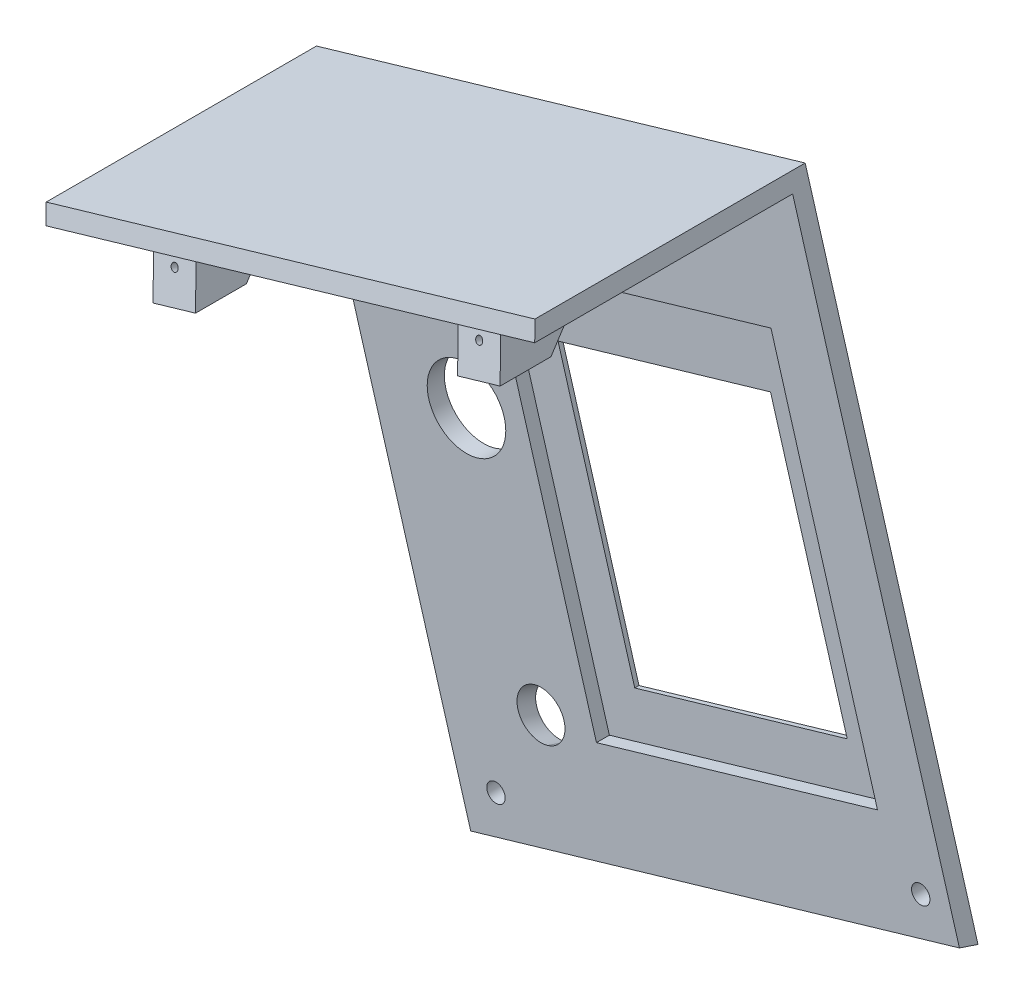
from build123d import *

# Parameters (mm, degrees)
SALIENTE_EXTRUIR1_START       = 2.11e-07
SALIENTE_EXTRUIR1_DEPTH       = 36.2755111
SALIENTE_EXTRUIR1_START_2     = 19.300740439
SALIENTE_EXTRUIR1_2_DEPTH     = 15.222231072
SALIENTE_EXTRUIR1_3_DEPTH     = 0.575969357
SALIENTE_EXTRUIR1_START_3     = 0.575969568
SALIENTE_EXTRUIR1_4_DEPTH     = 1.75
SALIENTE_EXTRUIR1_START_4     = -30.997891642
SALIENTE_EXTRUIR1_5_DEPTH     = 69
SALIENTE_EXTRUIR1_6_OUTLINE_W = 15.703224266
SALIENTE_EXTRUIR1_6_OUTLINE_H = 2.325969357
SALIENTE_EXTRUIR1_6_DEPTH     = 69
SALIENTE_EXTRUIR1_7_DEPTH     = 21.66081402
SALIENTE_EXTRUIR1_START_5     = 30.341294328
SALIENTE_EXTRUIR1_8_DEPTH     = 7.66081403
SALIENTE_EXTRUIR2_DEPTH       = 1
CROQUIS3_R                    = 1.25
CORTAR_EXTRUIR1_DEPTH         = 10
CROQUIS4_R                    = 5.324975084
CORTAR_EXTRUIR2_DEPTH         = 10
SALIENTE_EXTRUIR3_DEPTH       = 69
CORTAR_EXTRUIR3_DEPTH         = 69
SALIENTE_EXTRUIR4_REACH       = 101.278
CROQUIS7_R                    = 1.25
CROQUIS7_R_2                  = 0.5


with BuildPart() as part:
    # Saliente-Extruir1: read off the stored shape, not the designer's step
    # Saliente-Extruir1 outline → Saliente-Extruir1 (new body)
    with BuildSketch(Plane.XY.offset(SALIENTE_EXTRUIR1_START)):
        Polygon((-51.625046866, 66.023279607), (-50.996835351, 63.877170392), (15.224363662, 83.261514624), (14.596152147, 85.407623839), align=None)
    extrude(amount=SALIENTE_EXTRUIR1_DEPTH)

    # Saliente-Extruir1 2 outline → Saliente-Extruir1 2 (add)
    with BuildSketch(Plane.XY.offset(SALIENTE_EXTRUIR1_START_2)):
        Polygon((-35.641195, 68.372090794), (-41.399560131, 66.686495643), (-39.242610722, 59.317880312), (-33.484245591, 61.003475463), align=None)
        Polygon((5.627088443, 80.452189373), (-0.131276689, 78.766594222), (2.02567272, 71.397978892), (7.784037852, 73.083574042), align=None)
    extrude(amount=SALIENTE_EXTRUIR1_2_DEPTH)

    # Saliente-Extruir1 3 outline → Saliente-Extruir1 3 (add)
    # profile 1 of 3: a face of its own
    with BuildSketch(Plane.XY.offset(SALIENTE_EXTRUIR1_START)):
        Polygon((-35.641195, 68.372090794), (-41.399560131, 66.686495643), (-39.242610722, 59.317880312), (-33.484245591, 61.003475463), align=None)
    # profile 2 of 3: a face of its own
    with BuildSketch(Plane.XY.offset(SALIENTE_EXTRUIR1_START)):
        Polygon((5.627088443, 80.452189373), (-0.131276689, 78.766594222), (2.02567272, 71.397978892), (7.784037852, 73.083574042), align=None)
    # profile 3 of 3: a face of its own
    with BuildSketch(Plane.XY.offset(SALIENTE_EXTRUIR1_START)):
        Polygon((-25.796809543, 54.891581059), (-11.360360521, 5.573484337), (26.720065065, 16.720429561), (12.283616043, 66.038526283), align=None)
        Polygon((-18.597227896, 49.301446301), (10.194597762, 57.729422054), (20.870033716, 21.259776221), (-7.921791942, 12.831800468), align=None, mode=Mode.SUBTRACT)
    extrude(amount=SALIENTE_EXTRUIR1_3_DEPTH)

    # Saliente-Extruir1 4 outline → Saliente-Extruir1 4 (add)
    with BuildSketch(Plane.XY.offset(SALIENTE_EXTRUIR1_START_3)):
        Polygon((-35.641195, 68.372090794), (-41.399560131, 66.686495643), (-39.242610722, 59.317880312), (-33.484245591, 61.003475463), align=None)
        Polygon((5.627088443, 80.452189373), (-0.131276689, 78.766594222), (2.02567272, 71.397978892), (7.784037852, 73.083574042), align=None)
    extrude(amount=SALIENTE_EXTRUIR1_4_DEPTH)

    # Saliente-Extruir1 5 outline → Saliente-Extruir1 5 (cut)
    with BuildSketch(Plane(origin=(0, 0, 0), x_dir=(-0.2809325251095079, 0.9597275219225484, 0), z_dir=(0.9597275219225485, 0.2809325251095079, 0)).offset(SALIENTE_EXTRUIR1_START_4)):
        Polygon((67.953527999, 19.300740439), (75.631348175, 19.300740439), (67.953528, 27.634470761), align=None)
        Polygon((67.953528, 34.522971511), (75.631348175, 32.275511311), (75.631348175, 34.522971511), align=None)
        Polygon((75.631348175, 36.275511311), (77.867513301, 35.620938527), (77.867513301, 36.275511311), align=None)
    extrude(amount=SALIENTE_EXTRUIR1_5_DEPTH, mode=Mode.SUBTRACT)

    # Saliente-Extruir1 6 outline → Saliente-Extruir1 6 (add)
    with BuildSketch(Plane(origin=(0, 0, 0), x_dir=(-0.2809325251095079, 0.9597275219225484, 0), z_dir=(0.9597275219225485, 0.2809325251095079, 0)).offset(SALIENTE_EXTRUIR1_START_4)):
        with Locations((67.779736042, 1.16298489)):
            Rectangle(SALIENTE_EXTRUIR1_6_OUTLINE_W, SALIENTE_EXTRUIR1_6_OUTLINE_H)
        Polygon((8.540521078, 2.11e-07), (8.540521079, 2.325969568), (-5.302071851, 2.325969568), (-5.982932231, 2.11e-07), align=None)
    extrude(amount=SALIENTE_EXTRUIR1_6_DEPTH)

    # Saliente-Extruir1 7 outline → Saliente-Extruir1 7 (add)
    with BuildSketch(Plane(origin=(0, 0, 0), x_dir=(-0.2809325251095079, 0.9597275219225484, 0), z_dir=(0.9597275219225485, 0.2809325251095079, 0)).offset(SALIENTE_EXTRUIR1_START_4)):
        Polygon((59.928123909, 2.11e-07), (59.928123909, 2.325969568), (8.540521079, 2.325969568), (8.540521078, 2.11e-07), align=None)
    extrude(amount=SALIENTE_EXTRUIR1_7_DEPTH)

    # Saliente-Extruir1 8 outline → Saliente-Extruir1 8 (add)
    with BuildSketch(Plane(origin=(0, 0, 0), x_dir=(-0.2809325251095079, 0.9597275219225484, 0), z_dir=(0.9597275219225485, 0.2809325251095079, 0)).offset(SALIENTE_EXTRUIR1_START_5)):
        Polygon((59.928123909, 2.11e-07), (59.928123909, 2.325969568), (8.540521079, 2.325969568), (8.540521078, 2.11e-07), align=None)
    extrude(amount=SALIENTE_EXTRUIR1_8_DEPTH)

    # Saliente-Extruir1 9: loft between two sections, ruled curve by curve
    saliente_extruir1_9_from = [
        Edge.make_bspline([(-17.960997328, 1.936811392, 2.325969568), (-24.199226221, 0.110749979, 2.325969568), (-26.025287634, 6.348978871, 2.325969568), (-19.787058741, 8.175040285, 2.325969568)], [0, 0, 0, 0, 1, 1, 1, 1], 3, [1, 0.333333333, 0.333333333, 1]),
        Edge.make_bspline([(-19.787058741, 8.175040285, 2.325969568), (-13.548829849, 10.001101698, 2.325969568), (-11.722768436, 3.762872805, 2.325969568), (-17.960997328, 1.936811392, 2.325969568)], [0, 0, 0, 0, 1, 1, 1, 1], 3, [1, 0.333333333, 0.333333333, 1]),
    ]
    saliente_extruir1_9_to = [
        Edge.make_bspline([(-17.769721503, 1.283370947, 2.11e-07), (-24.007950395, -0.542690466, 2.11e-07), (-25.834011808, 5.695538426, 2.11e-07), (-19.595782916, 7.52159984, 2.11e-07)], [0, 0, 0, 0, 1, 1, 1, 1], 3, [1, 0.333333333, 0.333333333, 1]),
        Edge.make_bspline([(-19.595782916, 7.52159984, 2.11e-07), (-13.357554023, 9.347661253, 2.11e-07), (-11.53149261, 3.10943236, 2.11e-07), (-17.769721503, 1.283370947, 2.11e-07)], [0, 0, 0, 0, 1, 1, 1, 1], 3, [1, 0.333333333, 0.333333333, 1]),
    ]
    saliente_extruir1_9 = Solid(Shell([*[Face.make_surface_from_curves(saliente_extruir1_9_from[k], saliente_extruir1_9_to[k]) for k in range(2)], Face(Wire(saliente_extruir1_9_from)), Face(Wire(saliente_extruir1_9_to))]))
    add(saliente_extruir1_9, mode=Mode.SUBTRACT)

    # Saliente-Extruir1 10: loft between two sections, ruled curve by curve
    saliente_extruir1_10_from = [
        Edge.make_three_point_arc((5.262809235, 75.46739376, 30.520058845), (3.726126487, 76.267574249, 30.168893189), (2.86349043, 74.765062447, 30.520058845)),
        Edge.make_three_point_arc((2.86349043, 74.765062447, 30.520058845), (4.400173178, 73.964881958, 30.871224502), (5.262809235, 75.46739376, 30.520058845)),
    ]
    saliente_extruir1_10_to = [
        Edge.make_three_point_arc((5.026039984, 76.276249789, 33.399241411), (3.489357236, 77.076430278, 33.048075755), (2.626721179, 75.573918476, 33.399241411)),
        Edge.make_three_point_arc((2.626721179, 75.573918476, 33.399241411), (4.163403927, 74.773737987, 33.750407067), (5.026039984, 76.276249789, 33.399241411)),
    ]
    saliente_extruir1_10 = Solid(Shell([*[Face.make_surface_from_curves(saliente_extruir1_10_from[k], saliente_extruir1_10_to[k]) for k in range(2)], Face(Wire(saliente_extruir1_10_from)), Face(Wire(saliente_extruir1_10_to))]))
    add(saliente_extruir1_10, mode=Mode.SUBTRACT)

    # Saliente-Extruir1 11: loft between two sections, ruled curve by curve
    saliente_extruir1_11_from = [
        Edge.make_three_point_arc((-36.868110265, 61.884783379, 30.871224502), (-36.005474208, 63.387295181, 30.520058845), (-37.542156955, 64.18747567, 30.168893189)),
        Edge.make_three_point_arc((-37.542156955, 64.18747567, 30.168893189), (-38.404793012, 62.684963868, 30.520058845), (-36.868110265, 61.884783379, 30.871224502)),
    ]
    saliente_extruir1_11_to = [
        Edge.make_three_point_arc((-37.104879516, 62.693639407, 33.750407067), (-36.242243459, 64.196151209, 33.399241411), (-37.778926206, 64.996331698, 33.048075755)),
        Edge.make_three_point_arc((-37.778926206, 64.996331698, 33.048075755), (-38.641562263, 63.493819896, 33.399241411), (-37.104879516, 62.693639407, 33.750407067)),
    ]
    saliente_extruir1_11 = Solid(Shell([*[Face.make_surface_from_curves(saliente_extruir1_11_from[k], saliente_extruir1_11_to[k]) for k in range(2)], Face(Wire(saliente_extruir1_11_from)), Face(Wire(saliente_extruir1_11_to))]))
    add(saliente_extruir1_11, mode=Mode.SUBTRACT)

    # Saliente-Extruir1 12: loft between two sections, ruled curve by curve
    saliente_extruir1_12_from = [
        Edge.make_three_point_arc((-30.979047738, 39.986658971, 2.325969568), (-25.396077527, 36.932081486, 2.325969568), (-28.450655012, 31.349111274, 2.325969568)),
        Edge.make_three_point_arc((-28.450655012, 31.349111274, 2.325969568), (-34.033625224, 34.40368876, 2.325969568), (-30.979047738, 39.986658971, 2.325969568)),
    ]
    saliente_extruir1_12_to = [
        Edge.make_three_point_arc((-30.979047738, 39.986658971, 2.11e-07), (-25.396077527, 36.932081486, 2.11e-07), (-28.450655012, 31.349111274, 2.11e-07)),
        Edge.make_three_point_arc((-28.450655012, 31.349111274, 2.11e-07), (-34.033625224, 34.40368876, 2.11e-07), (-30.979047738, 39.986658971, 2.11e-07)),
    ]
    saliente_extruir1_12 = Solid(Shell([*[Face.make_surface_from_curves(saliente_extruir1_12_from[k], saliente_extruir1_12_to[k]) for k in range(2)], Face(Wire(saliente_extruir1_12_from)), Face(Wire(saliente_extruir1_12_to))]))
    add(saliente_extruir1_12, mode=Mode.SUBTRACT)

    # Croquis2 → Saliente-Extruir2 (add)
    with BuildSketch(Plane(origin=(-14.760341257, 50.424584095, 0), x_dir=(-0.9597275219225485, -0.28093252510950767, 0), z_dir=(0.28093252510950767, -0.9597275219225485, 0))):
        Polygon((3.997891642, -0.575969568), (-26.002108358, -0.575969568), (-26.002108358, -2.11e-07), (3.997891642, 0), align=None)
    extrude(amount=SALIENTE_EXTRUIR2_DEPTH)

    # Croquis3 → Cortar-Extruir1 (cut)
    with BuildSketch(Plane.XY.offset(2.325969568)):
        with Locations((32.57715474, 9.742255252)):
            Circle(CROQUIS3_R)
        with Locations((-24.975865422, -7.104729869)):
            Circle(CROQUIS3_R)
    extrude(amount=-CORTAR_EXTRUIR1_DEPTH, mode=Mode.SUBTRACT)

    # Croquis4 → Cortar-Extruir2 (cut)
    with BuildSketch(Plane(origin=(0, 0, 0), x_dir=(-1, 0, 0), z_dir=(0, 0, -1))):
        with Locations(Location((28.971074723, 36.024788725, 0), (0, 0, 90))):
            Circle(CROQUIS4_R)
    extrude(amount=-CORTAR_EXTRUIR2_DEPTH, mode=Mode.SUBTRACT)

    # Croquis5 → Saliente-Extruir3 (add)
    with BuildSketch(Plane(origin=(36.471669282, 10.67602826, 0), x_dir=(0, 0, -1), z_dir=(0.9597275219225486, 0.28093252510950756, 0))):
        Polygon((-36.275511311, 75.631348175), (-37.275511311, 75.631348175), (-36.620938527, 77.867513301), (-35.620938527, 77.867513301), align=None)
    extrude(amount=-SALIENTE_EXTRUIR3_DEPTH)

    # Croquis6 → Cortar-Extruir3 (cut)
    with BuildSketch(Plane(origin=(36.471669282, 10.67602826, 0), x_dir=(0, 0, -1), z_dir=(0.9597275219225486, 0.28093252510950756, 0))):
        Polygon((-2.325969568, -5.302071851), (-2.325969568, -4.802071851), (-2.11e-07, -5.482932231), (-2.11e-07, -5.982932231), align=None)
    extrude(amount=-CORTAR_EXTRUIR3_DEPTH, mode=Mode.SUBTRACT)

    # Croquis7 → Saliente-Extruir4 (add, up to next)
    with BuildSketch(Plane(origin=(-4.121600365, 14.080296693, 50.119852402), x_dir=(0.9968807084425405, 0.021345720862208265, 0.07598166447223464), z_dir=(-0.07892308366440427, 0.2696186761507921, 0.9597275219225484)), mode=Mode.PRIVATE) as saliente_extruir4_sk1:
        with Locations((-33.424563455, 52.432282093)):
            Circle(CROQUIS7_R)
        with Locations(Location((-33.424563455, 52.432282093, 0), (0, 0, 270.000000004))):
            Circle(CROQUIS7_R_2, mode=Mode.SUBTRACT)
    saliente_extruir4_tool1 = extrude(saliente_extruir4_sk1.sketch, amount=-SALIENTE_EXTRUIR4_REACH, mode=Mode.PRIVATE) - part.part
    # Croquis7 → Saliente-Extruir4 (add, up to next)
    with BuildSketch(Plane(origin=(-4.121600365, 14.080296693, 50.119852402), x_dir=(0.9968807084425405, 0.021345720862208265, 0.07598166447223464), z_dir=(-0.07892308366440427, 0.2696186761507921, 0.9597275219225484)), mode=Mode.PRIVATE) as saliente_extruir4_sk2:
        with Locations((7.972850592, 64.062162154)):
            Circle(CROQUIS7_R)
        with Locations(Location((7.972850592, 64.062162154, 0), (0, 0, 270.000000007))):
            Circle(CROQUIS7_R_2, mode=Mode.SUBTRACT)
    saliente_extruir4_tool2 = extrude(saliente_extruir4_sk2.sketch, amount=-SALIENTE_EXTRUIR4_REACH, mode=Mode.PRIVATE) - part.part
    add(saliente_extruir4_tool1.solids().sort_by_distance((-38.652759, 63.819058, 33.306951))[0])
    add(saliente_extruir4_tool2.solids().sort_by_distance((2.615525, 75.899157, 33.306951))[0])


solid = part.part
